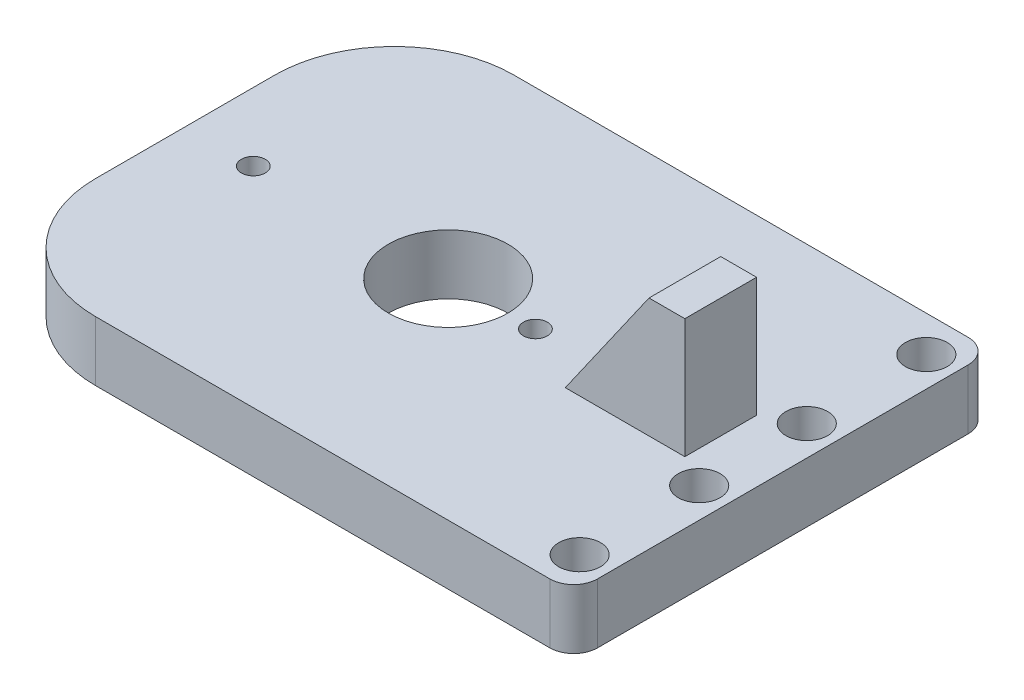
from build123d import *

# Parameters (mm, degrees)
SKETCH1_W           = 50
SKETCH1_H           = 35
SKETCH1_R           = 5
SKETCH1_R_2         = 1.75
BOSS_EXTRUDE1_DEPTH = 5
FILLET1_R           = 10
FILLET2_R           = 2
SKETCH2_W           = 10
SKETCH2_H           = 6
BOSS_EXTRUDE2_DEPTH = 10
CHAMFER1_SIZE2      = 7.002075382
CHAMFER1_SIZE       = 10
SKETCH3_R           = 1
CUT_EXTRUDE1_DEPTH  = 62.846584384


with BuildPart() as part:
    # Sketch1 → Boss-Extrude1 (new body)
    with BuildSketch(Plane(origin=(0, 0, 0), x_dir=(1, 0, 0), z_dir=(0, 1, 0))):
        with Locations((25, 17.5)):
            Rectangle(SKETCH1_W, SKETCH1_H)
        with Locations(Location((22, 17.5, 0), (0, 0, 270))):
            Circle(SKETCH1_R, mode=Mode.SUBTRACT)
        with Locations(Location((47.5, 32, 0), (0, 0, 270))):
            Circle(SKETCH1_R_2, mode=Mode.SUBTRACT)
        with Locations(Location((47.5, 22, 0), (0, 0, 270))):
            Circle(SKETCH1_R_2, mode=Mode.SUBTRACT)
        with Locations(Location((47.5, 13, 0), (0, 0, 270))):
            Circle(SKETCH1_R_2, mode=Mode.SUBTRACT)
        with Locations(Location((47.5, 3, 0), (0, 0, 270))):
            Circle(SKETCH1_R_2, mode=Mode.SUBTRACT)
    extrude(amount=BOSS_EXTRUDE1_DEPTH)

    # Fillet1
    fillet1_edges = [part.edges().sort_by_distance(p)[0] for p in [
        (0, 2.5, 0),
        (0, 2.5, -35),
    ]]
    fillet(fillet1_edges, radius=FILLET1_R)

    # Fillet2
    fillet2_edges = [part.edges().sort_by_distance(p)[0] for p in [
        (50, 2.5, -35),
        (50, 2.5, 0),
    ]]
    fillet(fillet2_edges, radius=FILLET2_R)

    # Sketch2 → Boss-Extrude2 (add)
    with BuildSketch(Plane(origin=(0, 5, 0), x_dir=(1, 0, 0), z_dir=(0, 1, 0))):
        with Locations((39.8, 17.5)):
            Rectangle(SKETCH2_W, SKETCH2_H)
    extrude(amount=BOSS_EXTRUDE2_DEPTH)

    # Chamfer1
    chamfer1_edges = [part.edges().sort_by_distance(p)[0] for p in [
        (34.8, 15, -17.5),
    ]]
    chamfer1_side = [part.faces().sort_by_distance(p)[0] for p in [
        (34.8, 14.859958492, -17.5),
    ]]
    chamfer(chamfer1_edges, length=CHAMFER1_SIZE - 0.0001, length2=CHAMFER1_SIZE2 - 0.0001, reference=chamfer1_side[0])  # a hair under: the kernel refuses the full size

    # Sketch3 → Cut-Extrude1 (cut, through all)
    with BuildSketch(Plane(origin=(0, 5, 0), x_dir=(1, 0, 0), z_dir=(0, 1, 0))):
        with Locations(Location((5.7, 17.5, 0), (0, 0, 270))):
            Circle(SKETCH3_R)
        with Locations(Location((29.3, 17.5, 0), (0, 0, 270))):
            Circle(SKETCH3_R)
    extrude(amount=-CUT_EXTRUDE1_DEPTH, mode=Mode.SUBTRACT)


solid = part.part
